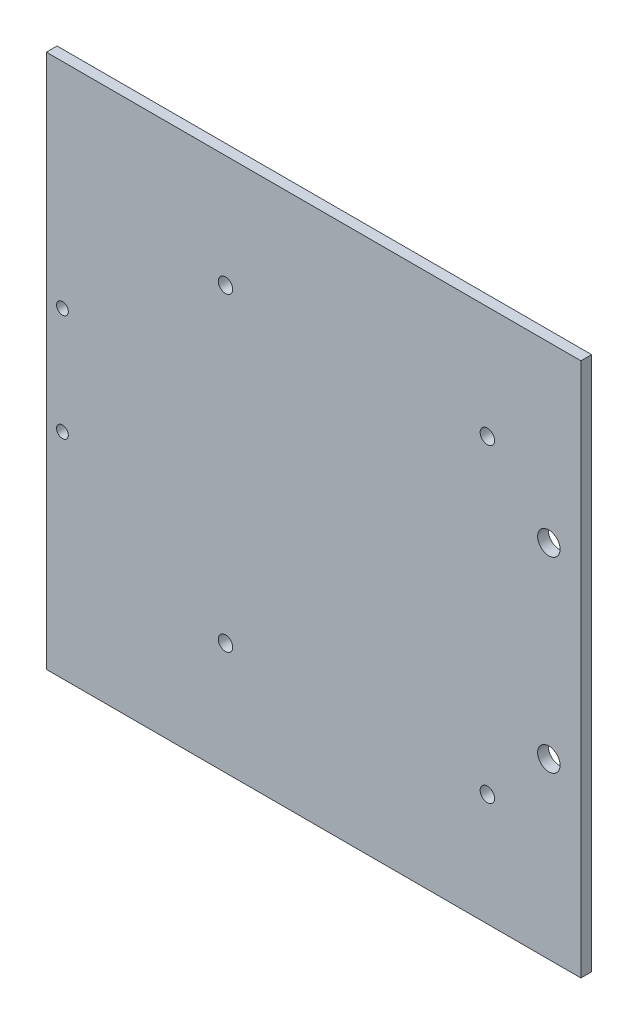
from build123d import *

# Parameters (mm, degrees)
SKETCH_1_W          = 100
SKETCH_1_H          = 100
SKETCH_1_R          = 1.1
EXTRUDE_1_DEPTH     = 2
SKETCH_3_R          = 1.35
CUT_EXTRUDE_1_DEPTH = 71.738956735
SKETCH_7_R          = 2.1
CUT_EXTRUDE_5_DEPTH = 10


with BuildPart() as part:
    # 草图1 → 凸台-拉伸1 (new body)
    with BuildSketch(Plane.XY):
        Rectangle(SKETCH_1_W, SKETCH_1_H)
        with Locations((-47, 10)):
            Circle(SKETCH_1_R, mode=Mode.SUBTRACT)
        with Locations((-47, -10)):
            Circle(SKETCH_1_R, mode=Mode.SUBTRACT)
    extrude(amount=EXTRUDE_1_DEPTH)

    # 草图3 → 切除-拉伸1 (cut, through all)
    with BuildSketch(Plane.XY.offset(2)):
        with Locations((-16.5, -29)):
            Circle(SKETCH_3_R)
        with Locations((-16.5, 29)):
            Circle(SKETCH_3_R)
        with Locations((32.5, 29)):
            Circle(SKETCH_3_R)
        with Locations((32.5, -29)):
            Circle(SKETCH_3_R)
    extrude(amount=-CUT_EXTRUDE_1_DEPTH, mode=Mode.SUBTRACT)

    # 草图7 → 切除-拉伸5 (cut)
    with BuildSketch(Plane.XY.offset(2)):
        with Locations((44, 17.5)):
            Circle(SKETCH_7_R)
        with Locations((44, -17.5)):
            Circle(SKETCH_7_R)
    extrude(amount=-CUT_EXTRUDE_5_DEPTH, mode=Mode.SUBTRACT)


solid = part.part
